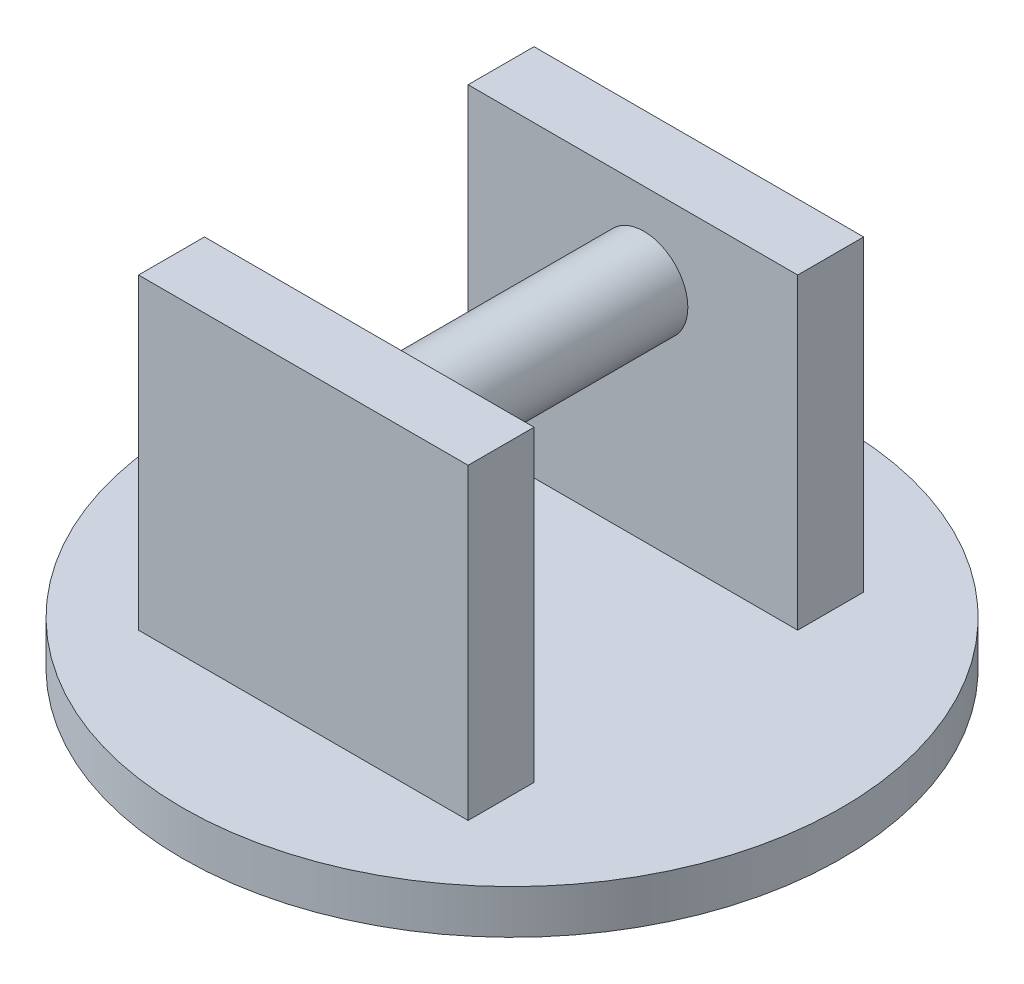
from build123d import *

# Parameters (mm, degrees)
SKETCH1_R           = 75
BOSS_EXTRUDE1_DEPTH = 10
SKETCH2_R           = 15
BOSS_EXTRUDE2_DEPTH = 25
SKETCH3_W           = 75
SKETCH3_H           = 15
BOSS_EXTRUDE3_DEPTH = 70
SKETCH4_R           = 10
BOSS_EXTRUDE4_DEPTH = 90


with BuildPart() as part:
    # Sketch1 → Boss-Extrude1 (new body)
    with BuildSketch(Plane(origin=(0, 0, 0), x_dir=(1, 0, 0), z_dir=(0, 1, 0))):
        Circle(SKETCH1_R)
    extrude(amount=BOSS_EXTRUDE1_DEPTH)

    # Sketch2 → Boss-Extrude2 (add)
    with BuildSketch(Plane(origin=(0, 0, 0), x_dir=(-1, 0, 0), z_dir=(0, -1, 0))):
        Circle(SKETCH2_R)
    extrude(amount=BOSS_EXTRUDE2_DEPTH)

    # Sketch3 → Boss-Extrude3 (add)
    with BuildSketch(Plane(origin=(0, 10, 0), x_dir=(1, 0, 0), z_dir=(0, 1, 0))):
        with Locations((-2.5, -37.5)):
            Rectangle(SKETCH3_W, SKETCH3_H)
        with Locations((-2.5, 37.5)):
            Rectangle(SKETCH3_W, SKETCH3_H)
    extrude(amount=BOSS_EXTRUDE3_DEPTH)

    # Sketch4 → Boss-Extrude4 (add)
    with BuildSketch(Plane.XY.offset(45)):
        with Locations((0, 61.110810205)):
            Circle(SKETCH4_R)
    extrude(amount=-BOSS_EXTRUDE4_DEPTH)


solid = part.part
